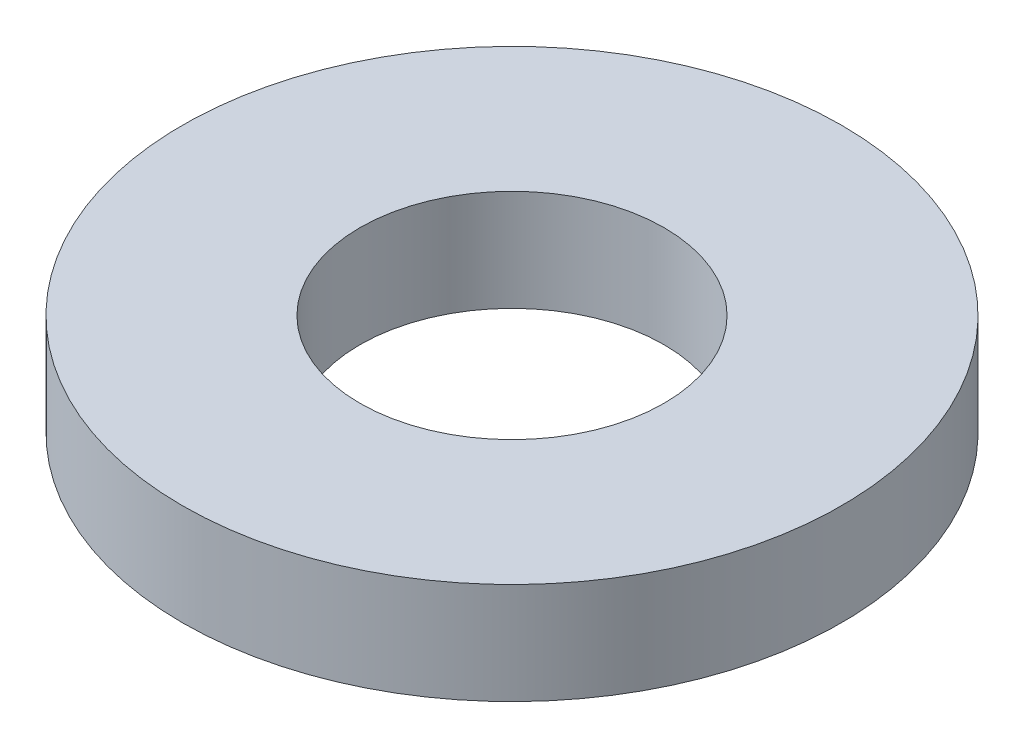
from build123d import *

# Parameters (mm, degrees)
SKETCH_1_R          = 13
EXTRUDE_1_DEPTH     = 4
SKETCH_2_R          = 6
CUT_EXTRUDE_1_DEPTH = 4


with BuildPart() as part:
    # 草图1 → 凸台-拉伸1 (new body)
    with BuildSketch(Plane(origin=(0, 0, 0), x_dir=(1, 0, 0), z_dir=(0, 1, 0))):
        Circle(SKETCH_1_R)
    extrude(amount=EXTRUDE_1_DEPTH)

    # 草图2 → 切除-拉伸1 (cut)
    with BuildSketch(Plane.XZ):
        Circle(SKETCH_2_R)
    extrude(amount=-CUT_EXTRUDE_1_DEPTH, mode=Mode.SUBTRACT)


solid = part.part
